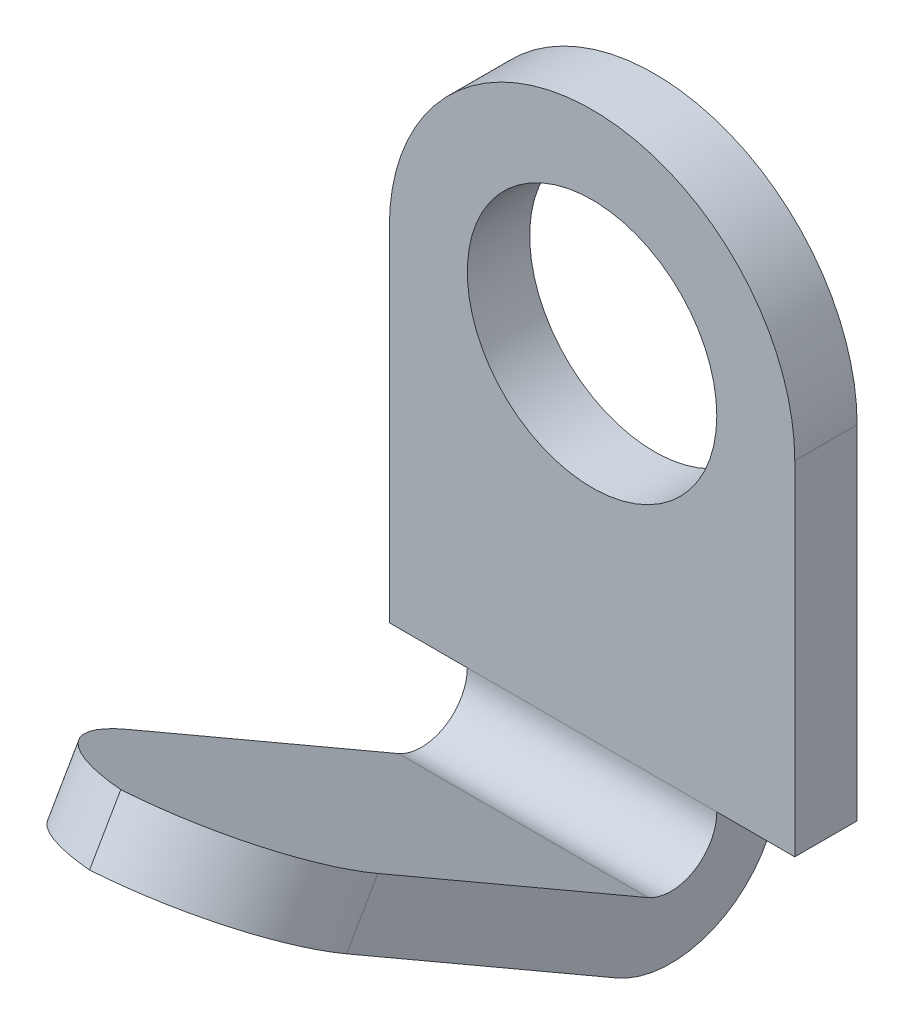
from build123d import *

# Parameters (mm, degrees)
SKETCH1_R           = 0.4
BOSS_EXTRUDE1_DEPTH = 0.2
BOSS_EXTRUDE2_DEPTH = 0.4
FILLET2_R           = 0.5


with BuildPart() as part:
    # Sketch1 → Boss-Extrude1 (new body)
    with BuildSketch(Plane.XY):
        with BuildLine():
            Line((-0.65, 0), (-0.65, -1.1))
            Line((-0.65, -1.1), (0.65, -1.1))
            Line((0.65, -1.1), (0.65, 0))
            ThreePointArc((0.65, 0), (0, 0.65), (-0.65, 0))
        make_face()
        Circle(SKETCH1_R, mode=Mode.SUBTRACT)
    extrude(amount=BOSS_EXTRUDE1_DEPTH)

    # Sketch2 → Boss-Extrude2 (add, symmetric)
    with BuildSketch(Plane(origin=(0, 0, 0), x_dir=(0, 0, -1), z_dir=(1, 0, 0))):
        with BuildLine():
            Line((-0.2, -1.1), (0, -1.1))
            ThreePointArc((0, -1.1), (-0.173653965, -1.40077749), (-0.520961894, -1.40077749))
            Line((-0.520961894, -1.40077749), (-1.82, -0.65077749))
            Line((-1.82, -0.65077749), (-1.72, -0.477572409))
            Line((-1.72, -0.477572409), (-0.420961894, -1.227572409))
            ThreePointArc((-0.420961894, -1.227572409), (-0.273653965, -1.227572409), (-0.2, -1.1))
        make_face()
    extrude(amount=BOSS_EXTRUDE2_DEPTH, both=True)

    # Fillet2
    # the kernel refuses this fillet: 0.5 mm, written as the material it takes off along each edge
    with BuildSketch(Plane(origin=(0.4, -1.733309245, 2.445), x_dir=(-1, 0, 0), z_dir=(0, 0.86602540378444, -0.49999999999999756)), Plane(origin=(-0.4, -1.733309245, 2.445), x_dir=(0, -0.49999999999999756, -0.86602540378444), z_dir=(0, 0.86602540378444, -0.49999999999999756))) as fillet2_piece_1:
        with BuildLine():
            CenterArc((FILLET2_R, -FILLET2_R), FILLET2_R, 90, 90)
            Line((0, -FILLET2_R), (0, 0))
            Line((0, 0), (FILLET2_R, 0))
        make_face()
    extrude(amount=2.7, mode=Mode.SUBTRACT)


solid = part.part
